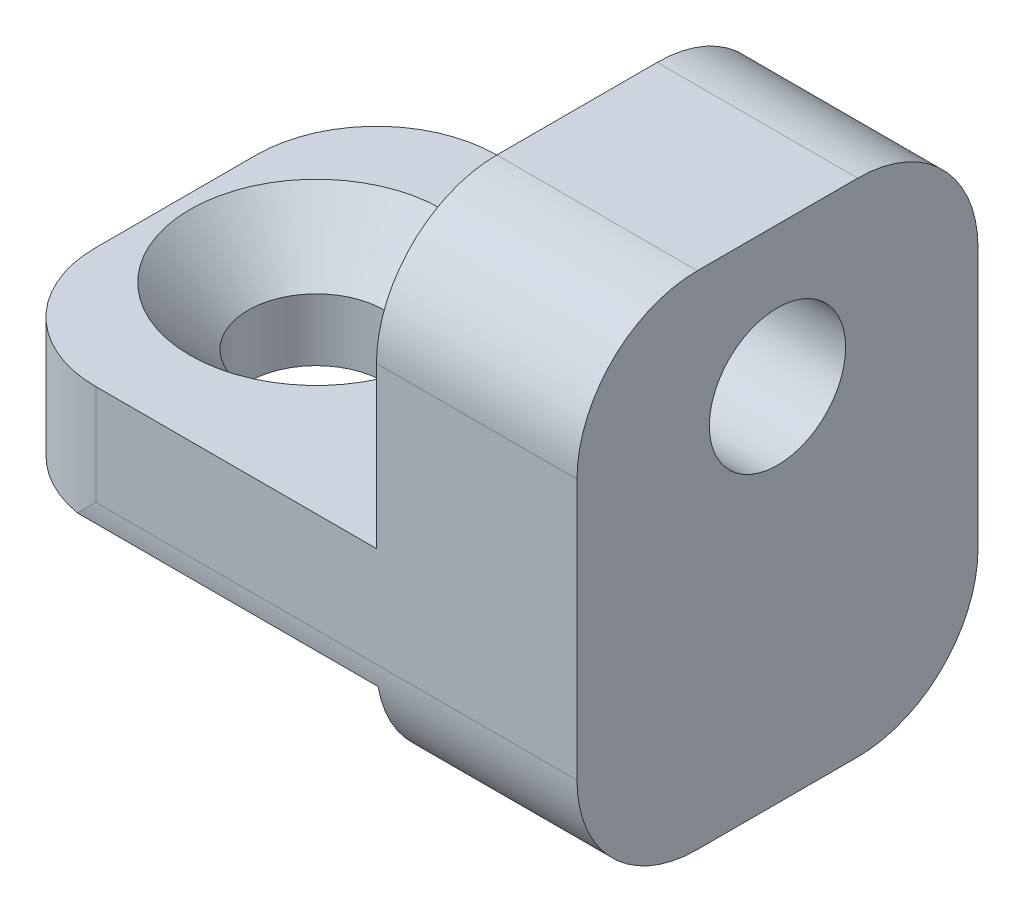
from build123d import *

# Parameters (mm, degrees)
BOSS_EXTRU_1_DEPTH                             = 10
ESQUISSE2_R                                    = 1.5
ENL_V_MAT_EXTRU_1_DEPTH                        = 5
ESQUISSE3_R                                    = 1.5
ENL_V_MAT_EXTRU_2_DEPTH                        = 3
D_GAGEMENT_M31_D                               = 3.4
D_GAGEMENT_M31_DEPTH                           = 5
D_GAGEMENT_M31_TIP                             = 1.021463052
FRAISAGE_POUR_VIS_T_TE_FRAIS_E_M31_D           = 3.4
FRAISAGE_POUR_VIS_T_TE_FRAIS_E_M31_DEPTH       = 3
FRAISAGE_POUR_VIS_T_TE_FRAIS_E_M31_CSINK_D     = 6.3
FRAISAGE_POUR_VIS_T_TE_FRAIS_E_M31_CSINK_ANGLE = 90
FRAISAGE_POUR_VIS_T_TE_FRAIS_E_M31_TIP         = 1.021463052
CONG_1_R                                       = 3


with BuildPart() as part:
    # Esquisse1 → Boss.-Extru.1 (new body)
    with BuildSketch(Plane.XY):
        Polygon((15, 0), (15, 10), (10, 10), (10, 3), (0, 3), (0, 0), (10, 0), (10, -2.5), (15, -2.5), align=None)
    extrude(amount=BOSS_EXTRU_1_DEPTH)

    # Esquisse2 → Enlèv. mat.-Extru.1 (cut)
    with BuildSketch(Plane(origin=(15, 0, 0), x_dir=(0, 0, -1), z_dir=(1, 0, 0))):
        with Locations((-5, 6.5)):
            Circle(ESQUISSE2_R)
    extrude(amount=-ENL_V_MAT_EXTRU_1_DEPTH, mode=Mode.SUBTRACT)

    # Esquisse3 → Enlèv. mat.-Extru.2 (cut)
    with BuildSketch(Plane(origin=(0, 3, 0), x_dir=(1, 0, 0), z_dir=(0, 1, 0))):
        with Locations(Location((3.5, -5, 0), (0, 0, 180))):
            Circle(ESQUISSE3_R)
    extrude(amount=-ENL_V_MAT_EXTRU_2_DEPTH, mode=Mode.SUBTRACT)

    # Dégagement M31
    with Locations(Plane(origin=(15, 0, 0), x_dir=(0, 0, -1), z_dir=(1, 0, 0))):
        with Locations((-5, 6.5)):
            Hole(D_GAGEMENT_M31_D / 2, depth=D_GAGEMENT_M31_DEPTH)
            with Locations((0, 0, -(D_GAGEMENT_M31_DEPTH + D_GAGEMENT_M31_TIP / 2))):  # 118° drill point
                Cone(0, D_GAGEMENT_M31_D / 2, D_GAGEMENT_M31_TIP, mode=Mode.SUBTRACT)

    # Fraisage pour vis à tête fraisée M31
    with Locations(Plane(origin=(0, 3, 0), x_dir=(1, 0, 0), z_dir=(0, 1, 0))):
        with Locations((3.5, -5)):
            CounterSinkHole(FRAISAGE_POUR_VIS_T_TE_FRAIS_E_M31_D / 2, FRAISAGE_POUR_VIS_T_TE_FRAIS_E_M31_CSINK_D / 2, depth=FRAISAGE_POUR_VIS_T_TE_FRAIS_E_M31_DEPTH, counter_sink_angle=FRAISAGE_POUR_VIS_T_TE_FRAIS_E_M31_CSINK_ANGLE)
            with Locations((0, 0, -(FRAISAGE_POUR_VIS_T_TE_FRAIS_E_M31_DEPTH + FRAISAGE_POUR_VIS_T_TE_FRAIS_E_M31_TIP / 2))):  # 118° drill point
                Cone(0, FRAISAGE_POUR_VIS_T_TE_FRAIS_E_M31_D / 2, FRAISAGE_POUR_VIS_T_TE_FRAIS_E_M31_TIP, mode=Mode.SUBTRACT)

    # Congé1
    # the kernel refuses this fillet: 3 mm, written as the material it takes off along each edge
    with BuildSketch(Plane(origin=(0, 10.5, 10), x_dir=(0, 0, -1), z_dir=(0, -1, 0))) as cong_1_piece_1:
        with BuildLine():
            CenterArc((CONG_1_R, CONG_1_R), CONG_1_R, 180, 90)
            Line((0, CONG_1_R), (0, 0))
            Line((0, 0), (CONG_1_R, 0))
        make_face()
    extrude(amount=18, mode=Mode.SUBTRACT)
    with BuildSketch(Plane(origin=(0, 10.5, 0), x_dir=(0, 0, 1), z_dir=(0, -1, 0))) as cong_1_piece_2:
        with BuildLine():
            CenterArc((CONG_1_R, -CONG_1_R), CONG_1_R, 90, 90)
            Line((0, -CONG_1_R), (0, 0))
            Line((0, 0), (CONG_1_R, 0))
        make_face()
    extrude(amount=18, mode=Mode.SUBTRACT)
    with BuildSketch(Plane(origin=(22.5, 10, 0), x_dir=(0, -1, 0), z_dir=(-1, 0, 0)), Plane(origin=(2.5, -2.5, 10), x_dir=(0, 0, -1), z_dir=(1, 0, 0))) as cong_1_piece_3:
        with BuildLine():
            CenterArc((CONG_1_R, CONG_1_R), CONG_1_R, 180, 90)
            Line((0, CONG_1_R), (0, 0))
            Line((0, 0), (CONG_1_R, 0))
        make_face()
    extrude(amount=20, mode=Mode.SUBTRACT)
    with BuildSketch(Plane(origin=(22.5, 10, 10), x_dir=(0, -1, 0), z_dir=(-1, 0, 0)), Plane(origin=(2.5, -2.5, 0), x_dir=(0, 0, 1), z_dir=(1, 0, 0))) as cong_1_piece_4:
        with BuildLine():
            CenterArc((CONG_1_R, -CONG_1_R), CONG_1_R, 90, 90)
            Line((0, -CONG_1_R), (0, 0))
            Line((0, 0), (CONG_1_R, 0))
        make_face()
    extrude(amount=20, mode=Mode.SUBTRACT)


solid = part.part
